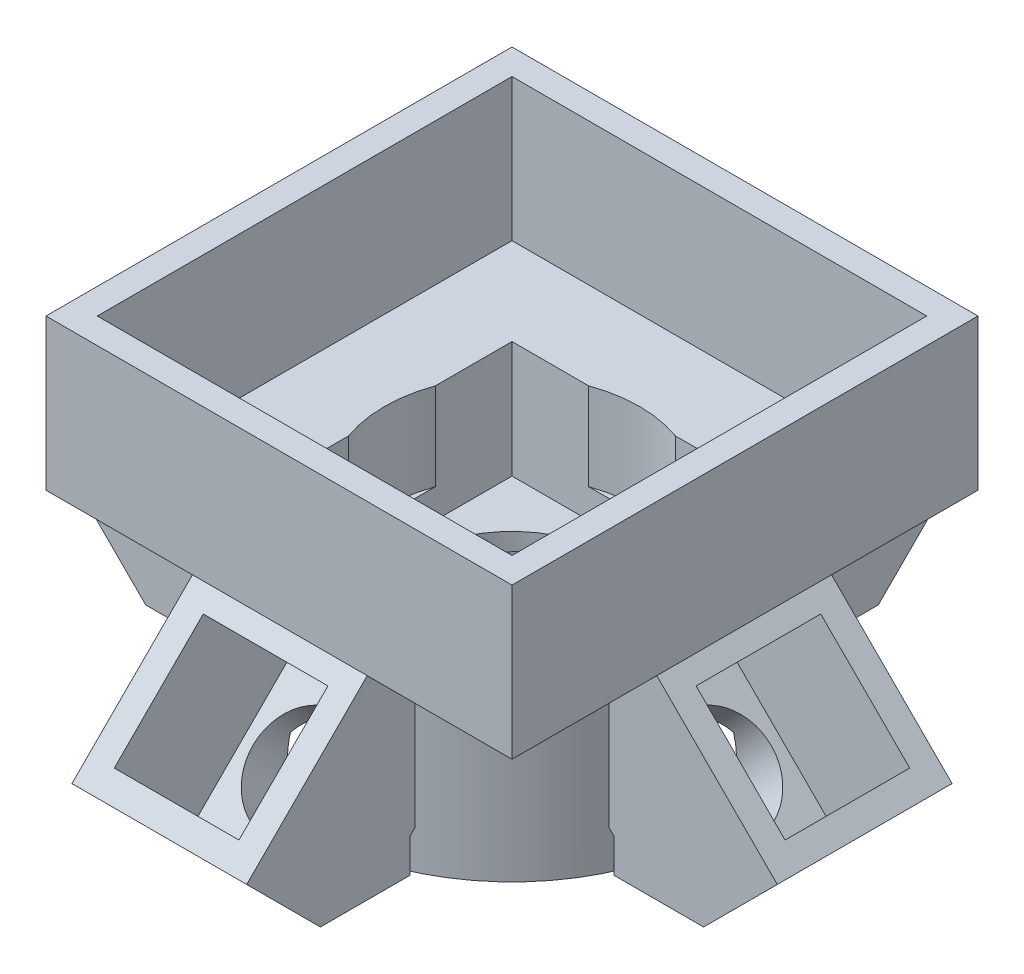
from build123d import *
from build123d.topology import SkipClean

# Parameters (mm, degrees)
SKETCH6_R            = 3
SKETCH6_R_2          = 2.19
BOSS_EXTRUDE3_DEPTH  = 2
SKETCH7_W            = 4.12
SKETCH7_H            = 4.12
CUT_EXTRUDE2_DEPTH   = 0.5
BOSS_EXTRUDE5_START  = 0.5
BOSS_EXTRUDE5_DEPTH  = 0.5
SKETCH17_R           = 3.5
SKETCH17_R_2         = 3
BOSS_EXTRUDE11_DEPTH = 0.5
BOSS_EXTRUDE12_START = 2
SKETCH18_R           = 3.5
SKETCH18_R_2         = 3.1
BOSS_EXTRUDE12_DEPTH = 2
BOSS_EXTRUDE13_DEPTH = 1.5
SKETCH29_W           = 3
SKETCH29_H           = 3
BOSS_EXTRUDE16_DEPTH = 1.5
SKETCH30_W           = 2.12
SKETCH30_H           = 2.12
CUT_EXTRUDE10_DEPTH  = 2.645512986
SKETCH31_W           = 2.22
SKETCH31_H           = 2.22
BOSS_EXTRUDE17_DEPTH = 1.27
SKETCH32_R           = 0.89
CUT_EXTRUDE11_DEPTH  = 8.729286762
SKETCH33_W           = 3.2
SKETCH33_H           = 3.2
CUT_EXTRUDE12_DEPTH  = 0.18
CIRPATTERN3_COUNT    = 4
SKETCH34_W           = 2.12
SKETCH34_H           = 2.12
CUT_EXTRUDE13_DEPTH  = 2.645512986
SKETCH35_W           = 2.14
SKETCH35_H           = 2.16
CUT_EXTRUDE14_DEPTH  = 2.21
SKETCH36_W           = 2.12
SKETCH36_H           = 2.12
CUT_EXTRUDE15_DEPTH  = 2.645512986
CIRPATTERN16_COUNT   = 4
SKETCH37_R           = 10
CUT_EXTRUDE17_DEPTH  = 0.5
SKETCH38_R           = 3.5
SKETCH38_R_2         = 2.85
BOSS_EXTRUDE18_DEPTH = 1.5
SKETCH39_W           = 2.12
SKETCH39_H           = 2.12
CUT_EXTRUDE18_DEPTH  = 0.5
SKETCH40_W           = 8
SKETCH40_H           = 8
SKETCH40_W_2         = 7
SKETCH40_H_2         = 7
BOSS_EXTRUDE19_DEPTH = 2.44
BOSS_EXTRUDE20_START = 0.15
SKETCH41_W           = 8
SKETCH41_H           = 8
SKETCH41_R           = 2.19
BOSS_EXTRUDE20_DEPTH = 0.15
SKETCH42_W           = 8
SKETCH42_H           = 8
SKETCH42_R           = 2.19
BOSS_EXTRUDE21_DEPTH = 0.733937
BOSS_EXTRUDE21_DRAFT = 45
SKETCH43_W           = 7.12
SKETCH43_H           = 7.12
CUT_EXTRUDE19_DEPTH  = 10
SKETCH44_W           = 4.12
SKETCH44_H           = 4.12
CUT_EXTRUDE20_DEPTH  = 10
BOSS_EXTRUDE22_START = 0.3
BOSS_EXTRUDE22_DEPTH = 0.3
SKETCH47_R           = 1.75
CUT_EXTRUDE21_DEPTH  = 4.3
CIRPATTERN22_COUNT   = 4


with BuildPart() as part:
    # Sketch6 → Boss-Extrude3 (new body)
    with BuildSketch(Plane(origin=(0, 0, 0), x_dir=(1, 0, 0), z_dir=(0, 1, 0))):
        with Locations(Location((0, 0, 0), (0, 0, 270))):
            Circle(SKETCH6_R)
        with Locations(Location((0, 0, 0), (0, 0, 270))):
            Circle(SKETCH6_R_2, mode=Mode.SUBTRACT)
    extrude(amount=BOSS_EXTRUDE3_DEPTH)

    # Sketch7 → Cut-Extrude2 (cut)
    with BuildSketch(Plane(origin=(0, 0, 0), x_dir=(-1, 0, 0), z_dir=(0, -1, 0))):
        Rectangle(SKETCH7_W, SKETCH7_H)
    extrude(amount=-CUT_EXTRUDE2_DEPTH, mode=Mode.SUBTRACT)

    # Sketch8 → Boss-Extrude5 (add)
    with BuildSketch(Plane(origin=(0, 0.5, 0), x_dir=(-1, 0, 0), z_dir=(0, -1, 0)).offset(BOSS_EXTRUDE5_START)):
        with BuildLine():
            Line((-0.743303437, 2.06), (0.743303437, 2.06))
            ThreePointArc((0.743303437, 2.06), (0, 2.19), (-0.743303437, 2.06))
        make_face()
        with BuildLine():
            Line((-2.06, 0.743303437), (-2.06, -0.743303437))
            ThreePointArc((-2.06, -0.743303437), (-2.19, 0), (-2.06, 0.743303437))
        make_face()
        with BuildLine():
            Line((-0.743303437, -2.06), (0.743303437, -2.06))
            ThreePointArc((0.743303437, -2.06), (0, -2.19), (-0.743303437, -2.06))
        make_face()
        with BuildLine():
            Line((2.06, 0.743303437), (2.06, -0.743303437))
            ThreePointArc((2.06, -0.743303437), (2.19, 0), (2.06, 0.743303437))
        make_face()
    extrude(amount=-BOSS_EXTRUDE5_DEPTH)

    # Sketch17 → Boss-Extrude11 (add)
    with BuildSketch(Plane(origin=(0, 0, 0), x_dir=(-1, 0, 0), z_dir=(0, -1, 0))):
        with Locations(Location((0, 0, 0), (0, 0, 90))):
            Circle(SKETCH17_R)
        with Locations(Location((0, 0, 0), (0, 0, 90))):
            Circle(SKETCH17_R_2, mode=Mode.SUBTRACT)
    extrude(amount=-BOSS_EXTRUDE11_DEPTH)

    # Sketch18 → Boss-Extrude12 (add)
    with BuildSketch(Plane(origin=(0, 0, 0), x_dir=(-1, 0, 0), z_dir=(0, -1, 0)).offset(BOSS_EXTRUDE12_START)):
        with Locations(Location((0, 0, 0), (0, 0, 90))):
            Circle(SKETCH18_R)
        with Locations(Location((0, 0, 0), (0, 0, 90))):
            Circle(SKETCH18_R_2, mode=Mode.SUBTRACT)
    extrude(amount=-BOSS_EXTRUDE12_DEPTH)

    # Sketch19 → Boss-Extrude13 (add, symmetric)
    with BuildSketch(Plane.XY):
        Polygon((4.288855584, -2), (5.121320344, -1.167535241), (3, 0.953785103), (2.19, 0.143785103), (3.250660172, -0.916875069), (3.250660172, -2), (4.033756176, -2), align=None)
    boss_extrude13 = extrude(amount=BOSS_EXTRUDE13_DEPTH, both=True)

    # Sketch29 → Boss-Extrude16 (add)
    with BuildSketch(Plane(origin=(1.976892551, 1.976892551, 0), x_dir=(0, 0, -1), z_dir=(0.707106781186548, 0.7071067811865471, 0))):
        with Locations((0, -2.94689243)):
            Rectangle(SKETCH29_W, SKETCH29_H)
    boss_extrude16 = extrude(amount=BOSS_EXTRUDE16_DEPTH)

    # Sketch30 → Cut-Extrude10 (cut)
    with BuildSketch(Plane(origin=(3.037552723, 3.037552723, 0), x_dir=(0, 0, -1), z_dir=(0.707106781186548, 0.7071067811865471, 0))):
        with Locations((0, -2.94689243)):
            Rectangle(SKETCH30_W, SKETCH30_H)
    extrude(amount=-CUT_EXTRUDE10_DEPTH, mode=Mode.SUBTRACT)

    # Sketch31 → Boss-Extrude17 (add)
    with BuildSketch(Plane(origin=(1.166892551, 1.166892551, 0), x_dir=(0, 0, 1), z_dir=(-0.7071067811865441, -0.7071067811865509, 0))):
        with Locations((-0.05, -2.89689243)):
            Rectangle(SKETCH31_W, SKETCH31_H)
    boss_extrude17 = extrude(amount=-BOSS_EXTRUDE17_DEPTH)

    # Sketch32 → Cut-Extrude11 (cut, symmetric)
    with BuildSketch(Plane(origin=(2.064918163, 2.064918163, 0), x_dir=(0, 0, -1), z_dir=(0.7071067811865444, 0.7071067811865508, 0))):
        with Locations(Location((0, -2.94689243, 0), (0, 0, 155.726539294))):
            Circle(SKETCH32_R)
    cut_extrude11 = extrude(amount=CUT_EXTRUDE11_DEPTH, both=True, mode=Mode.SUBTRACT)

    # Sketch33 → Cut-Extrude12 (cut)
    with BuildSketch(Plane(origin=(3.037552723, 3.037552723, 0), x_dir=(0, 0, -1), z_dir=(0.707106781186548, 0.7071067811865471, 0))):
        with Locations((0, -2.94689243)):
            Rectangle(SKETCH33_W, SKETCH33_H)
    cut_extrude12 = extrude(amount=-CUT_EXTRUDE12_DEPTH, mode=Mode.SUBTRACT)

    # CirPattern3: Boss-Extrude13, Boss-Extrude16 ×4 about axis
    cirpattern3_axis = Axis((0, 0, 0), (0, 1, 0))
    add([boss_extrude13.rotate(cirpattern3_axis, i * 360 / CIRPATTERN3_COUNT) for i in range(1, CIRPATTERN3_COUNT)])
    add([boss_extrude16.rotate(cirpattern3_axis, i * 360 / CIRPATTERN3_COUNT) for i in range(1, CIRPATTERN3_COUNT)])

    # Sketch34 → Cut-Extrude13 (cut)
    with BuildSketch(Plane(origin=(-3.037552723, 3.037552723, 0), x_dir=(0, 0, 1), z_dir=(-0.707106781186548, 0.7071067811865471, 0))):
        with Locations((0, -2.94689243)):
            Rectangle(SKETCH34_W, SKETCH34_H)
    extrude(amount=-CUT_EXTRUDE13_DEPTH, mode=Mode.SUBTRACT)

    # Sketch35 → Cut-Extrude14 (cut)
    with BuildSketch(Plane(origin=(0, 3.037552723, -3.037552723), x_dir=(1, 0, 0), z_dir=(7.355440612690688e-15, 0.7071067811865471, -0.707106781186548))):
        with Locations((0, 2.94689243)):
            Rectangle(SKETCH35_W, SKETCH35_H)
    cut_extrude14 = extrude(amount=-CUT_EXTRUDE14_DEPTH, mode=Mode.SUBTRACT)

    # Sketch36 → Cut-Extrude15 (cut)
    with BuildSketch(Plane(origin=(0, 3.037552723, 3.037552723), x_dir=(1, 0, 0), z_dir=(-2.417740350526155e-15, 0.7071067811865471, 0.707106781186548))):
        with Locations((0, -2.94689243)):
            Rectangle(SKETCH36_W, SKETCH36_H)
    extrude(amount=-CUT_EXTRUDE15_DEPTH, mode=Mode.SUBTRACT)

    # CirPattern16: Boss-Extrude17, Cut-Extrude11, Cut-Extrude12 ×4 about axis
    cirpattern16_axis = Axis((0, 0, 0), (0, 1, 0))
    add([boss_extrude17.rotate(cirpattern16_axis, i * 360 / CIRPATTERN16_COUNT) for i in range(1, CIRPATTERN16_COUNT)])
    add([cut_extrude11.rotate(cirpattern16_axis, i * 360 / CIRPATTERN16_COUNT) for i in range(1, CIRPATTERN16_COUNT)], mode=Mode.SUBTRACT)
    add([cut_extrude12.rotate(cirpattern16_axis, i * 360 / CIRPATTERN16_COUNT) for i in range(1, CIRPATTERN16_COUNT)], mode=Mode.SUBTRACT)

    # Sketch37 → Cut-Extrude17 (cut)
    with BuildSketch(Plane.XZ.offset(2)):
        Circle(SKETCH37_R)
    extrude(amount=-CUT_EXTRUDE17_DEPTH, mode=Mode.SUBTRACT)

    # Sketch38 → Boss-Extrude18 (add)
    with BuildSketch(Plane(origin=(0, 0.5, 0), x_dir=(1, 0, 0), z_dir=(0, 1, 0))):
        with Locations(Location((0, 0, 0), (0, 0, 111.75765302))):
            Circle(SKETCH38_R)
        Circle(SKETCH38_R_2, mode=Mode.SUBTRACT)
    extrude(amount=BOSS_EXTRUDE18_DEPTH)

    # Sketch39 → Cut-Extrude18 (cut)
    with SkipClean():  # the faces are left unmerged after this step: merging them gives an invalid solid
        with BuildSketch(Plane(origin=(0, 2.064918163, -2.064918163), x_dir=(1, 0, 0), z_dir=(-2.4688501310822543e-15, 0.7071067811865508, -0.7071067811865444))):
            with Locations((0, 2.94689243)):
                Rectangle(SKETCH39_W, SKETCH39_H)
        extrude(amount=CUT_EXTRUDE18_DEPTH, mode=Mode.SUBTRACT)
    add(part.part.scale(1), mode=Mode.REPLACE)  # the faces are merged on a copy



with BuildPart() as body_2:
    # Sketch40 → Boss-Extrude19 (new body)
    with BuildSketch(Plane(origin=(0, 2, 0), x_dir=(1, 0, 0), z_dir=(0, 1, 0))):
        Rectangle(SKETCH40_W, SKETCH40_H)
        Rectangle(SKETCH40_W_2, SKETCH40_H_2, mode=Mode.SUBTRACT)
    extrude(amount=BOSS_EXTRUDE19_DEPTH)


with BuildPart() as part_1:
    with SkipClean():  # the faces are left unmerged after this step: merging them gives an invalid solid
        add(part.part)

        add(body_2.part)  # Boss-Extrude20 merges body 2
        # Sketch41 → Boss-Extrude20 (add)
        with BuildSketch(Plane.XZ.offset(-2).offset(BOSS_EXTRUDE20_START)):
            Rectangle(SKETCH41_W, SKETCH41_H)
            with Locations(Location((0, 0, 0), (0, 0, 289.840808046))):
                Circle(SKETCH41_R, mode=Mode.SUBTRACT)
        extrude(amount=-BOSS_EXTRUDE20_DEPTH)


with BuildPart() as boss_extrude21_tool:
    # Sketch42 → Boss-Extrude21 (with draft: the straight prism first)
    with BuildSketch(Plane.XZ.offset(-1.85)):
        Rectangle(SKETCH42_W, SKETCH42_H)
        with Locations(Location((0, 0, 0), (0, 0, 289.840808046))):
            Circle(SKETCH42_R, mode=Mode.SUBTRACT)
    extrude(amount=BOSS_EXTRUDE21_DEPTH)
    # Boss-Extrude21: the draft: its side faces are tilted about the plane it starts from
    boss_extrude21_sides = [boss_extrude21_tool.faces().sort_by_distance(p)[0] for p in [
        (-4, 1.4830315, 0),
        (0, 1.4830315, -4),
        (4, 1.4830315, 0),
        (0, 1.4830315, 4),
        (-0.743303437, 1.4830315, 2.06),
    ]]
    draft(boss_extrude21_sides, Plane.XZ.offset(-1.85), BOSS_EXTRUDE21_DRAFT)


with BuildPart() as part_2:
    add(part_1.part)

    # Boss-Extrude21: add boss_extrude21_tool
    add(boss_extrude21_tool.part)

    # Sketch43 → Cut-Extrude19 (cut)
    with BuildSketch(Plane(origin=(0, 2, 0), x_dir=(1, 0, 0), z_dir=(0, 1, 0))):
        Rectangle(SKETCH43_W, SKETCH43_H)
    extrude(amount=CUT_EXTRUDE19_DEPTH, mode=Mode.SUBTRACT)

    # Sketch44 → Cut-Extrude20 (cut)
    with BuildSketch(Plane(origin=(0, 0.5, 0), x_dir=(-1, 0, 0), z_dir=(0, -1, 0))):
        Rectangle(SKETCH44_W, SKETCH44_H)
    extrude(amount=-CUT_EXTRUDE20_DEPTH, mode=Mode.SUBTRACT)

    # Sketch46 → Boss-Extrude22 (add)
    with BuildSketch(Plane.XZ.offset(BOSS_EXTRUDE22_START)):
        with BuildLine():
            Line((-2.333785103, 1.5), (-2.712931993, 1.5))
            ThreePointArc((-2.712931993, 1.5), (-2.192031022, 2.192031022), (-1.5, 2.712931993))
            Line((-1.5, 2.712931993), (-1.5, 2.333785103))
            Line((-1.5, 2.333785103), (1.5, 2.333785103))
            Line((1.5, 2.333785103), (1.5, 2.712931993))
            ThreePointArc((1.5, 2.712931993), (2.192031022, 2.192031022), (2.712931993, 1.5))
            Line((2.712931993, 1.5), (2.333785103, 1.5))
            Line((2.333785103, 1.5), (2.333785103, -1.5))
            Line((2.333785103, -1.5), (2.712931993, -1.5))
            ThreePointArc((2.712931993, -1.5), (2.192031022, -2.192031022), (1.5, -2.712931993))
            Line((1.5, -2.712931993), (1.5, -2.333785103))
            Line((1.5, -2.333785103), (-1.5, -2.333785103))
            Line((-1.5, -2.333785103), (-1.5, -2.712931993))
            ThreePointArc((-1.5, -2.712931993), (-2.192031022, -2.192031022), (-2.712931993, -1.5))
            Line((-2.712931993, -1.5), (-2.333785103, -1.5))
            Line((-2.333785103, -1.5), (-2.333785103, 1.5))
        make_face()
    extrude(amount=-BOSS_EXTRUDE22_DEPTH)

    # Sketch47 → Cut-Extrude21 (cut)
    with BuildSketch(Plane.XZ.offset(0.3)):
        with Locations(Location((0, 0, 0), (0, 0, 270))):
            Circle(SKETCH47_R)
    extrude(amount=-CUT_EXTRUDE21_DEPTH, mode=Mode.SUBTRACT)

    # CirPattern22: Cut-Extrude14 ×4 about axis
    cirpattern22_axis = Axis((0, 0, 0), (0, 1, 0))
    for i in range(1, CIRPATTERN22_COUNT):
        add(cut_extrude14.rotate(cirpattern22_axis, i * 360 / CIRPATTERN22_COUNT), mode=Mode.SUBTRACT)


solid = part_2.part
